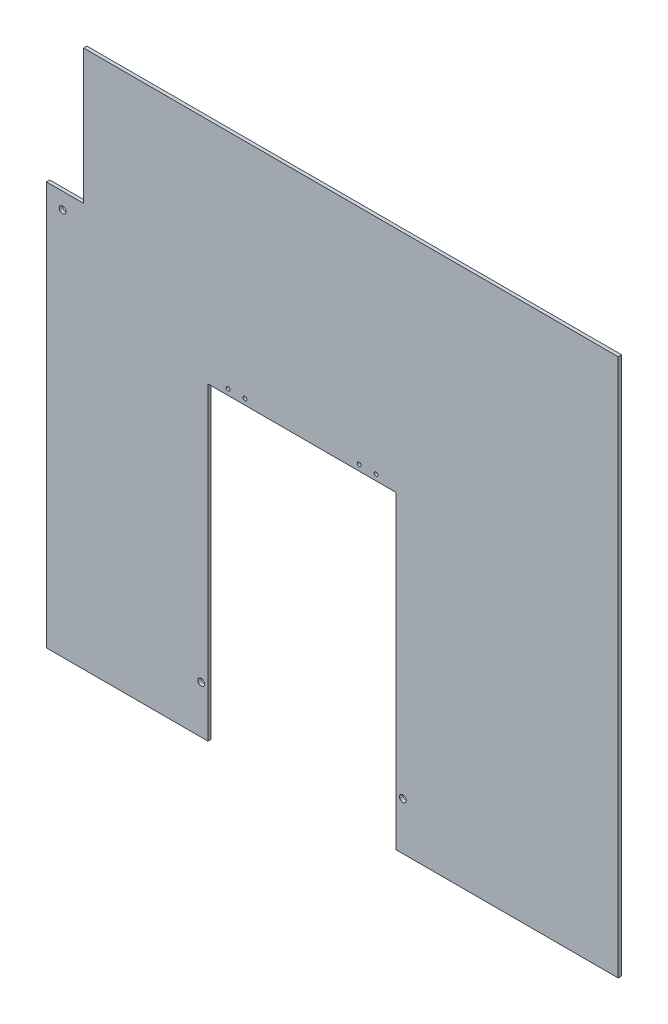
from build123d import *

# Parameters (mm, degrees)
SKETCH1_W           = 539.75
SKETCH1_H           = 508
BOSS_EXTRUDE1_DEPTH = 3.175
SKETCH2_R           = 3.175
SKETCH2_W           = 177.8
SKETCH2_H           = 292.1
CUT_EXTRUDE1_DEPTH  = 44.45
SKETCH3_W           = 34.925
SKETCH3_H           = 127
CUT_EXTRUDE2_DEPTH  = 742.218013222
SKETCH4_R           = 1.8034
CUT_EXTRUDE3_DEPTH  = 742.218013222


with BuildPart() as part:
    # Sketch1 → Boss-Extrude1 (new body)
    with BuildSketch(Plane.XY):
        with Locations((269.875, 254)):
            Rectangle(SKETCH1_W, SKETCH1_H)
    extrude(amount=BOSS_EXTRUDE1_DEPTH)

    # Sketch2 → Cut-Extrude1 (cut)
    with BuildSketch(Plane(origin=(0, 0, 0), x_dir=(-1, 0, 0), z_dir=(0, 0, -1))):
        with Locations((-336.55, 45.085)):
            Circle(SKETCH2_R)
        with Locations((-146.05, 45.085)):
            Circle(SKETCH2_R)
        with Locations((-15.24, 365.76)):
            Circle(SKETCH2_R)
        with Locations((-241.3, 146.05)):
            Rectangle(SKETCH2_W, SKETCH2_H)
    extrude(amount=-CUT_EXTRUDE1_DEPTH, mode=Mode.SUBTRACT)

    # Sketch3 → Cut-Extrude2 (cut, through all)
    with BuildSketch(Plane(origin=(0, 0, 0), x_dir=(-1, 0, 0), z_dir=(0, 0, -1))):
        with Locations((-17.4625, 444.5)):
            Rectangle(SKETCH3_W, SKETCH3_H)
    extrude(amount=-CUT_EXTRUDE2_DEPTH, mode=Mode.SUBTRACT)

    # Sketch4 → Cut-Extrude3 (cut, through all)
    with BuildSketch(Plane(origin=(0, 0, 0), x_dir=(-1, 0, 0), z_dir=(0, 0, -1))):
        with Locations((-311.1754, 297.6372)):
            Circle(SKETCH4_R)
        with Locations((-295.3004, 297.6372)):
            Circle(SKETCH4_R)
        with Locations((-187.3504, 297.6372)):
            Circle(SKETCH4_R)
        with Locations((-171.4754, 297.6372)):
            Circle(SKETCH4_R)
    extrude(amount=-CUT_EXTRUDE3_DEPTH, mode=Mode.SUBTRACT)


solid = part.part
